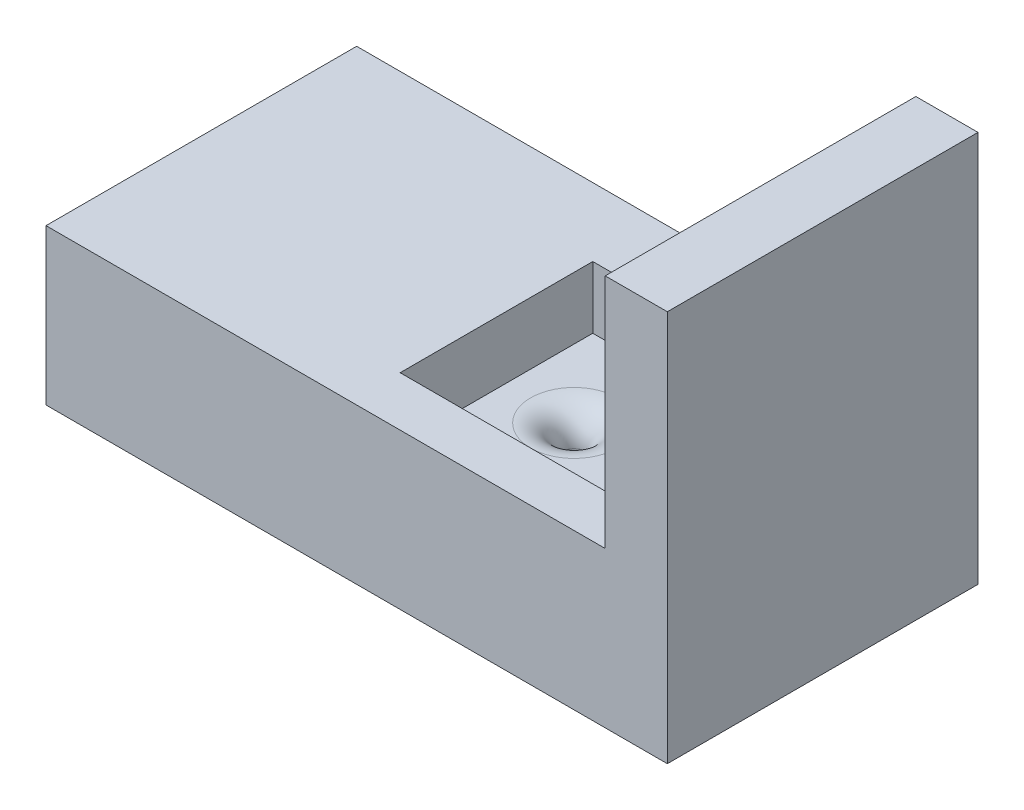
from build123d import *

# Parameters (mm, degrees)
SKETCH1_W           = 100
SKETCH1_H           = 50
SKETCH1_W_2         = 41
SKETCH1_H_2         = 31
BOSS_EXTRUDE1_DEPTH = 10
SKETCH2_W           = 10
SKETCH2_H           = 38
BOSS_EXTRUDE2_DEPTH = 50
SKETCH10_W          = 100
SKETCH10_H          = 50
SKETCH10_R          = 2
BOSS_EXTRUDE6_DEPTH = 5
SKETCH12_W          = 1.8
SKETCH12_H          = 10
FILLET4_R           = 2
SKETCH13_W          = 100
SKETCH13_H          = 50
SKETCH13_R          = 6
BOSS_EXTRUDE7_DEPTH = 10
FILLET5_R           = 5


with BuildPart() as part:
    # Sketch1 → Boss-Extrude1 (new body)
    with BuildSketch(Plane(origin=(0, 0, 0), x_dir=(1, 0, 0), z_dir=(0, 1, 0))):
        with Locations((20, 0)):
            Rectangle(SKETCH1_W, SKETCH1_H)
        with Locations((39.5, -1.5)):
            Rectangle(SKETCH1_W_2, SKETCH1_H_2, mode=Mode.SUBTRACT)
    extrude(amount=BOSS_EXTRUDE1_DEPTH)

    # Sketch2 → Boss-Extrude2 (add)
    with BuildSketch(Plane.XY.offset(25)):
        with Locations((65, 29)):
            Rectangle(SKETCH2_W, SKETCH2_H)
    extrude(amount=-BOSS_EXTRUDE2_DEPTH)

    # Sketch10 → Boss-Extrude6 (add)
    with BuildSketch(Plane.XZ):
        with Locations((20, 0)):
            Rectangle(SKETCH10_W, SKETCH10_H)
        with Locations((30, 0)):
            Circle(SKETCH10_R, mode=Mode.SUBTRACT)
    extrude(amount=BOSS_EXTRUDE6_DEPTH)

    # Sketch12 → Revolve3 (revolve)
    with BuildSketch(Plane.XY):
        with Locations((32.9, -10)):
            Rectangle(SKETCH12_W, SKETCH12_H)
    revolve(axis=Axis((30, -5, 0), (0, -1, 0)))

    # Fillet4
    fillet4_edges = [part.edges().sort_by_distance(p)[0] for p in [
        (26.2, -5, 0),
    ]]
    fillet(fillet4_edges, radius=FILLET4_R)

    # Sketch13 → Boss-Extrude7 (add)
    with BuildSketch(Plane.XZ.offset(5)):
        with Locations((20, 0)):
            Rectangle(SKETCH13_W, SKETCH13_H)
        with Locations((30, 0)):
            Circle(SKETCH13_R, mode=Mode.SUBTRACT)
    extrude(amount=BOSS_EXTRUDE7_DEPTH)

    # Fillet5
    fillet5_edges = [part.edges().sort_by_distance(p)[0] for p in [
        (28, 0, 0),
    ]]
    fillet(fillet5_edges, radius=FILLET5_R)


solid = part.part
